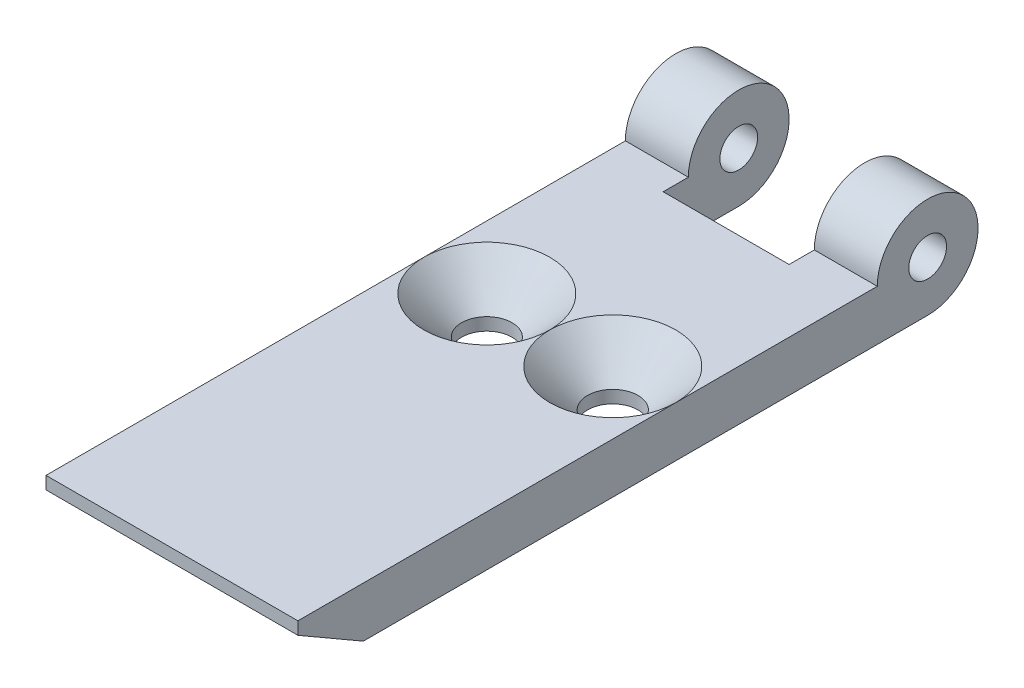
from build123d import *

# Parameters (mm, degrees)
SKETCH_1_R               = 1.5
EXTRUDE_1_DEPTH          = 10
CUT_EXTRUDE_1_DEPTH      = 52.14684741
CUT_EXTRUDE_1_DEPTH_BACK = 52.14684741
SKETCH_2_R               = 2
SKETCH_2_W               = 10
SKETCH_2_H               = 10
CHAMFER_1_SIZE           = 3


with BuildPart() as part:
    # 草图1 → 凸台-拉伸1 (new, symmetric)
    with BuildSketch(Plane(origin=(0, 0, 0), x_dir=(0, 0, -1), z_dir=(1, 0, 0))):
        with BuildLine():
            Line((0, -4), (-44.803847577, -4))
            Line((-44.803847577, -4), (-50, -1))
            Line((-50, -1), (-50, 0))
            Line((-50, 0), (-4, 0))
            ThreePointArc((-4, 0), (2.828427125, 2.828427125), (0, -4))
        make_face()
        Circle(SKETCH_1_R, mode=Mode.SUBTRACT)
    extrude(amount=EXTRUDE_1_DEPTH, both=True)

    # 草图2 → 切除-拉伸1 (cut, two sides: drawn at the far end of the back side and taken through both)
    with BuildSketch(Plane(origin=(0, 0, 0), x_dir=(1, 0, 0), z_dir=(0, 1, 0)).offset(-CUT_EXTRUDE_1_DEPTH_BACK)):
        with Locations(Location((-5, -20, 0), (0, 0, 270))):
            Circle(SKETCH_2_R)
        with Locations(Location((5, -20, 0), (0, 0, 270))):
            Circle(SKETCH_2_R)
        with Locations((0, -1)):
            Rectangle(SKETCH_2_W, SKETCH_2_H)
    extrude(amount=CUT_EXTRUDE_1_DEPTH + CUT_EXTRUDE_1_DEPTH_BACK, mode=Mode.SUBTRACT)

    # 倒角1
    chamfer_1_edges = [part.edges().sort_by_distance(p)[0] for p in [
        (5, 0, 18),
        (-5, 0, 18),
    ]]
    chamfer(chamfer_1_edges, length=CHAMFER_1_SIZE - 0.0001)  # a hair under: the kernel refuses the full size


solid = part.part
